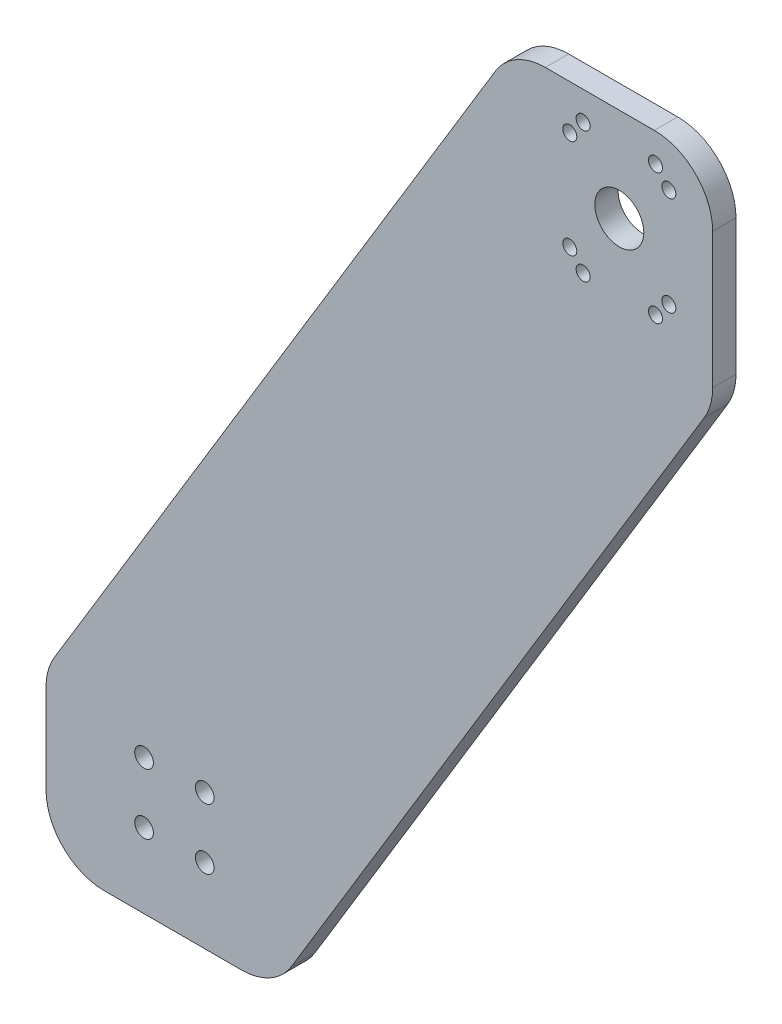
from build123d import *

# Parameters (mm, degrees)
SCHIZZO1_R                   = 4
SCHIZZO1_R_2                 = 10.5
SCHIZZO1_R_3                 = 3
ESTRUSIONE_ESTRUSIONE2_DEPTH = 10
SCHIZZO2_R                   = 2
TAGLIO_ESTRUSIONE1_DEPTH     = 15


with BuildPart() as part:
    # Schizzo1 → Estrusione-Estrusione2 (new body)
    with BuildSketch(Plane.XY):
        with BuildLine():
            Line((25, 0), (83.810825302, 0))
            ThreePointArc((83.810825302, 0), (96.083419143, 3.219654722), (105.194931806, 12.049324766))
            Line((105.194931806, 12.049324766), (282.024381214, 304.029450185))
            ThreePointArc((282.024381214, 304.029450185), (284.71933888, 310.257129904), (285.64027471, 316.980125419))
            Line((285.64027471, 316.980125419), (285.64027471, 375))
            ThreePointArc((285.64027471, 375), (278.31794424, 392.67766953), (260.64027471, 400))
            Line((260.64027471, 400), (213.941879948, 400))
            ThreePointArc((213.941879948, 400), (201.669286107, 396.780345278), (192.557773444, 387.950675234))
            Line((192.557773444, 387.950675234), (3.615893496, 75.970549815))
            ThreePointArc((3.615893496, 75.970549815), (0.92093583, 69.742870096), (0, 63.019874581))
            Line((0, 63.019874581), (0, 25))
            ThreePointArc((0, 25), (7.32233047, 7.32233047), (25, 0))
        make_face()
        with Locations((42.005015941, 58)):
            Circle(SCHIZZO1_R, mode=Mode.SUBTRACT)
        with Locations((68.005015941, 58)):
            Circle(SCHIZZO1_R, mode=Mode.SUBTRACT)
        with Locations((68.005015941, 32)):
            Circle(SCHIZZO1_R, mode=Mode.SUBTRACT)
        with Locations((42.005015941, 32)):
            Circle(SCHIZZO1_R, mode=Mode.SUBTRACT)
        with Locations((245.64027471, 359.776226195)):
            Circle(SCHIZZO1_R_2, mode=Mode.SUBTRACT)
        with Locations((230.14027471, 387.776226195)):
            Circle(SCHIZZO1_R_3, mode=Mode.SUBTRACT)
        with Locations((261.14027471, 387.776226195)):
            Circle(SCHIZZO1_R_3, mode=Mode.SUBTRACT)
        with Locations((266.853478146, 380.98942963)):
            Circle(SCHIZZO1_R_3, mode=Mode.SUBTRACT)
        with Locations((266.853478146, 338.563022759)):
            Circle(SCHIZZO1_R_3, mode=Mode.SUBTRACT)
        with Locations((261.14027471, 331.776226195)):
            Circle(SCHIZZO1_R_3, mode=Mode.SUBTRACT)
        with Locations((230.14027471, 331.776226195)):
            Circle(SCHIZZO1_R_3, mode=Mode.SUBTRACT)
        with Locations((224.427071275, 338.563022759)):
            Circle(SCHIZZO1_R_3, mode=Mode.SUBTRACT)
        with Locations((224.427071275, 380.98942963)):
            Circle(SCHIZZO1_R_3, mode=Mode.SUBTRACT)
    extrude(amount=-ESTRUSIONE_ESTRUSIONE2_DEPTH)

    # Schizzo2 → Taglio-Estrusione1 (cut)
    with BuildSketch(Plane.XZ):
        with Locations((54.405412651, -5)):
            Circle(SCHIZZO2_R)
        with Locations((81.905412651, -5)):
            Circle(SCHIZZO2_R)
        with Locations((26.905412651, -5)):
            Circle(SCHIZZO2_R)
    extrude(amount=-TAGLIO_ESTRUSIONE1_DEPTH, mode=Mode.SUBTRACT)


solid = part.part
